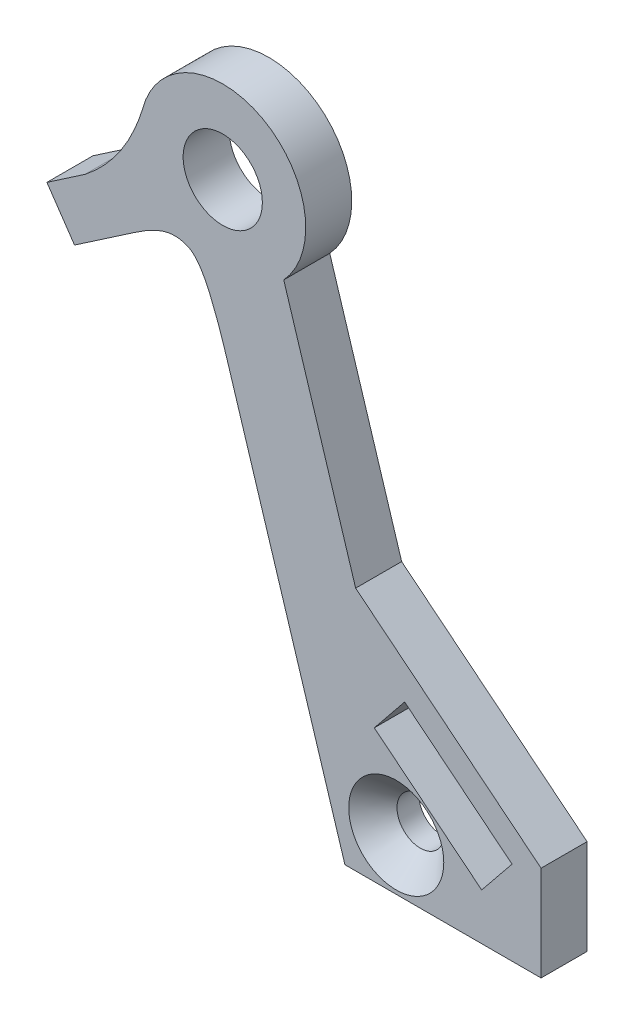
from build123d import *

# Parameters (mm, degrees)
SKETCH1_R           = 1.5
SKETCH1_R_2         = 2.625
BOSS_EXTRUDE1_DEPTH = 3.05


with BuildPart() as part:
    # Sketch1 → Boss-Extrude1 (new body)
    with BuildSketch(Plane.XY):
        with BuildLine():
            Line((-7.813226831, 25.104795624), (0, 0))
            Line((0, 0), (13, 0))
            Line((13, 0), (13, 6.303908615))
            Line((13, 6.303908615), (0.708529353, 16.231634907))
            Line((0.708529353, 16.231634907), (-4.057068102, 31.544047144))
            ThreePointArc((-4.057068102, 31.544047144), (-5.473136356, 40.107888765), (-13.427731373, 36.633834833))
            add(Edge.make_bspline(
                [(-17.229515242, 31.01562696), (-14.514237852, 33.142129435), (-13.427731373, 36.633834833)],
                knots=[0, 0, 0, 1, 1, 1], degree=2))
            Line((-17.229515242, 31.01562696), (-19.754600441, 29.293942889))
            Line((-19.754600441, 29.293942889), (-17.9237303, 26.608721385))
            Line((-17.9237303, 26.608721385), (-13.932796466, 29.329868067))
            add(Edge.make_bspline(
                [(-13.932796466, 29.329868067), (-12.381551692, 30.407849096), (-10.691589638, 30.789278346), (-9.223592818, 29.609717336), (-7.813226831, 25.104795624)],
                knots=[0, 0, 0, 0, 0.517103648, 1, 1, 1, 1], degree=3))
        make_face()
        with Locations((3.4, 3.4)):
            Circle(SKETCH1_R, mode=Mode.SUBTRACT)
        Polygon((11.073847559, 5.572751724), (9.110294099, 3.141685535), (9.063168816, 3.083339947), (1.945007017, 8.832624477), (3.95568576, 11.322036253), align=None, mode=Mode.SUBTRACT)
        with Locations((-8.098279353, 35.2748127)):
            Circle(SKETCH1_R_2, mode=Mode.SUBTRACT)
    extrude(amount=BOSS_EXTRUDE1_DEPTH)

    # Sketch3 → CSK for M3 Flat Head Machine Screw1 (revolve, cut)
    with BuildSketch(Plane(origin=(3.4, 3.4, 3.05), x_dir=(0, -1, 0), z_dir=(1, 0, 0))):
        Polygon((0, 0), (0, 3.05), (1.55, 3.05), (1.55, 1.6), (3.15, 0), align=None)
    revolve(axis=Axis((3.4, 3.4, 9.4), (0, 0, -1)), mode=Mode.SUBTRACT)


solid = part.part
